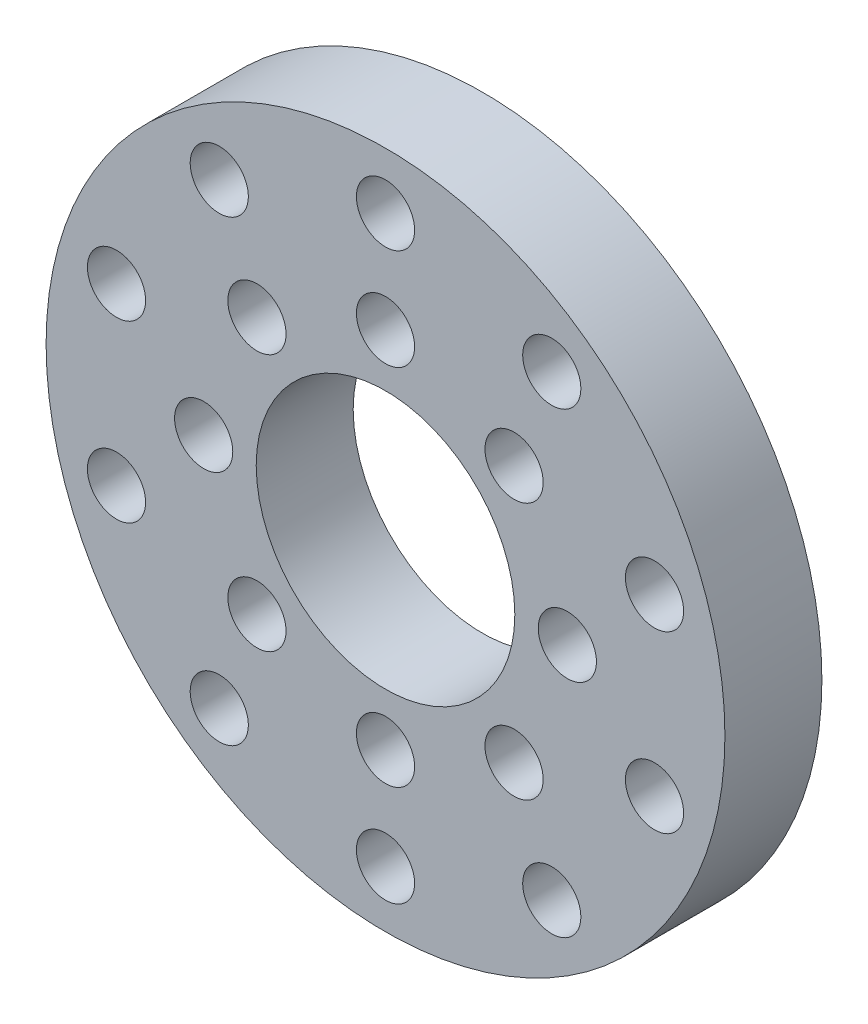
from build123d import *

# Parameters (mm, degrees)
SKETCH_1_R               = 21
EXTRUDE_1_DEPTH          = 6
SKETCH_2_R               = 8
CUT_EXTRUDE_1_DEPTH      = 8
PATTERN_CIRCULAR_1_COUNT = 8
PATTERN_CIRCULAR_2_COUNT = 10


with BuildPart() as part:
    # 草图1 → 凸台-拉伸1 (new body)
    with BuildSketch(Plane.XY):
        Circle(SKETCH_1_R)
    extrude(amount=EXTRUDE_1_DEPTH)

    # 草图2 → 切除-拉伸1 (cut)
    with BuildSketch(Plane(origin=(0, 0, 0), x_dir=(-1, 0, 0), z_dir=(0, 0, -1))):
        Circle(SKETCH_2_R)
    extrude(amount=-CUT_EXTRUDE_1_DEPTH, mode=Mode.SUBTRACT)

    # 草图7 → 打孔尺寸(%根据)内六角圆柱头螺钉的类型1 (revolve, cut)
    with BuildSketch(Plane(origin=(0, 11.25, 0), x_dir=(0, 1, 0), z_dir=(1, 0, 0))):
        Polygon((0, 0), (0, 8.581549114), (1.8, 7.5), (1.8, 3.4), (3, 3.4), (3, 0), align=None)
    hole_wizard_1 = revolve(axis=Axis((0, 11.25, -6.35), (0, 0, 1)), mode=Mode.SUBTRACT)

    # 阵列(圆周)1: 打孔尺寸(%根据)内六角圆柱头螺钉的类型1 ×8 about axis
    pattern_circular_1_axis = Axis((0, 0, 6), (0, 0, -1))
    for i in range(1, PATTERN_CIRCULAR_1_COUNT):
        add(hole_wizard_1.rotate(pattern_circular_1_axis, i * 360 / PATTERN_CIRCULAR_1_COUNT), mode=Mode.SUBTRACT)

    # 草图13 → 打孔尺寸(%根据)内六角圆柱头螺钉的类型7 (revolve, cut)
    with BuildSketch(Plane(origin=(0, 17.5, 0), x_dir=(0, 1, 0), z_dir=(1, 0, 0))):
        Polygon((0, 0), (0, 8.581549114), (1.8, 7.5), (1.8, 3.4), (3, 3.4), (3, 0), align=None)
    hole_wizard_7 = revolve(axis=Axis((0, 17.5, -6.35), (0, 0, 1)), mode=Mode.SUBTRACT)

    # 阵列(圆周)2: 打孔尺寸(%根据)内六角圆柱头螺钉的类型7 ×10 about axis
    pattern_circular_2_axis = Axis((0, 0, 6), (0, 0, -1))
    for i in range(1, PATTERN_CIRCULAR_2_COUNT):
        add(hole_wizard_7.rotate(pattern_circular_2_axis, i * 360 / PATTERN_CIRCULAR_2_COUNT), mode=Mode.SUBTRACT)


solid = part.part
